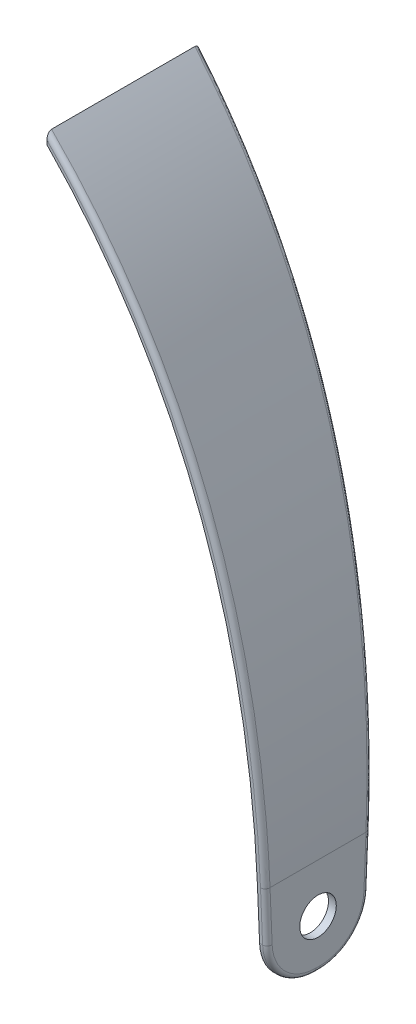
from build123d import *

# Parameters (mm, degrees)
BOSS_EXTRUDE1_DEPTH            = 22.225
CUT_EXTRUDE1_REACH             = 331.298
SKETCH2_R                      = 4.7625
CUT_EXTRUDE1_DIRECTION_2_REACH = 331.298
CUT_EXTRUDE2_DEPTH             = 254
FILLET1_R                      = 12.7
FILLET4_R                      = 1.2446
F_1_4_CLEARANCE_HOLE1_D        = 6.5278
F_1_4_CLEARANCE_HOLE1_DEPTH    = 6.35
F_1_4_CLEARANCE_HOLE1_TIP      = 1.961148974
SKETCH8_W                      = 63.920753762
SKETCH8_H                      = 259.326964074
CUT_EXTRUDE5_DEPTH             = 480.06
SKETCH9_R                      = 0.762
CUT_EXTRUDE6_DEPTH             = 0.508
SKETCH10_R                     = 0.762
BOSS_EXTRUDE2_DEPTH            = 0.508
SKETCH7_W                      = 53.894876093
SKETCH7_H                      = 277.088175353
CUT_EXTRUDE4_DEPTH             = 200.66


with BuildPart() as part:
    # Sketch1 → Boss-Extrude1 (new, symmetric)
    with BuildSketch(Plane.XY):
        with BuildLine():
            add(Edge.make_bspline(
                [(247.65, 12.7), (247.65, 151.138652105), (159.851901214, 215.9), (69.85, 215.9)],
                knots=[0, 0, 0, 0, 1, 1, 1, 1], degree=3))
            Line((69.85, 215.9), (-69.85, 215.9))
            add(Edge.make_bspline(
                [(-69.85, 215.9), (-159.851901214, 215.9), (-247.65, 151.138652105), (-247.65, 12.7)],
                knots=[0, 0, 0, 0, 1, 1, 1, 1], degree=3))
            Line((-247.65, 12.7), (-247.65, -12.7))
            Line((-247.65, -12.7), (-245.618, -12.7))
            Line((-245.618, -12.7), (-245.618, 12.7))
            add(Edge.make_bspline(
                [(-69.85, 213.868), (-75.40386678, 213.868), (-86.529134162, 213.367524052), (-108.503296863, 210.348405687), (-135.224023579, 202.760511588), (-165.078062417, 187.457160851), (-187.304904565, 169.454437631), (-203.008125467, 151.842675097), (-213.624406237, 137.012147223), (-222.956422719, 120.542434531), (-230.879834274, 102.41559311), (-237.26896978, 82.613605898), (-241.209008074, 64.702111997), (-243.466672055, 49.517673174), (-244.696729955, 37.702743517), (-245.322441099, 27.489835839), (-245.575395866, 19.120958406), (-245.618, 14.831688899), (-245.618, 12.7)],
                knots=[0, 0, 0, 0, 0.0625, 0.125, 0.25, 0.375, 0.5, 0.5625, 0.625, 0.6875, 0.75, 0.8125, 0.875, 0.90625, 0.9375, 0.96875, 0.984375, 1, 1, 1, 1], degree=3))
            Line((-69.85, 213.868), (69.85, 213.868))
            add(Edge.make_bspline(
                [(245.618, 12.7), (245.618, 14.831688899), (245.575395866, 19.120958406), (245.322441099, 27.489835839), (244.696729955, 37.702743517), (243.466672055, 49.517673174), (241.209008074, 64.702111997), (237.26896978, 82.613605898), (230.879834274, 102.41559311), (222.956422719, 120.542434531), (213.624406237, 137.012147223), (203.008125467, 151.842675097), (187.304904565, 169.454437631), (165.078062417, 187.457160851), (135.224023579, 202.760511588), (108.503296863, 210.348405687), (86.529134162, 213.367524052), (75.40386678, 213.868), (69.85, 213.868)],
                knots=[0, 0, 0, 0, 0.015625, 0.03125, 0.0625, 0.09375, 0.125, 0.1875, 0.25, 0.3125, 0.375, 0.4375, 0.5, 0.625, 0.75, 0.875, 0.9375, 1, 1, 1, 1], degree=3))
            Line((245.618, 12.7), (245.618, -12.7))
            Line((245.618, -12.7), (247.65, -12.7))
            Line((247.65, -12.7), (247.65, 12.7))
        make_face()
    extrude(amount=BOSS_EXTRUDE1_DEPTH, both=True)

    # Sketch2 → Cut-Extrude1 (cut, up to next)
    with BuildSketch(Plane(origin=(0, 0, 0), x_dir=(0, 0, -1), z_dir=(1, 0, 0)), mode=Mode.PRIVATE) as cut_extrude1_sk1:
        Circle(SKETCH2_R)
    cut_extrude1_tool1 = extrude(cut_extrude1_sk1.sketch, amount=-CUT_EXTRUDE1_REACH, mode=Mode.PRIVATE) & part.part
    add(cut_extrude1_tool1.solids().sort_by_distance((0, 0, 0))[0], mode=Mode.SUBTRACT)

    # Sketch2 → Cut-Extrude1 direction 2 (cut, up to next)
    with BuildSketch(Plane(origin=(0, 0, 0), x_dir=(0, 0, -1), z_dir=(1, 0, 0)), mode=Mode.PRIVATE) as cut_extrude1_direction_2_sk1:
        Circle(SKETCH2_R)
    cut_extrude1_direction_2_tool1 = extrude(cut_extrude1_direction_2_sk1.sketch, amount=CUT_EXTRUDE1_DIRECTION_2_REACH, mode=Mode.PRIVATE) & part.part
    add(cut_extrude1_direction_2_tool1.solids().sort_by_distance((0, 0, 0))[0], mode=Mode.SUBTRACT)

    # Sketch3 → Cut-Extrude2 (cut, symmetric)
    with BuildSketch(Plane(origin=(0, 0, 0), x_dir=(0, 0, -1), z_dir=(1, 0, 0))):
        Polygon((-22.225, 215.9), (-12.7, -12.7), (-47.625, -12.7), (-47.625, 215.9), align=None)
        Polygon((22.225, 215.9), (12.7, -12.7), (47.625, -12.7), (47.625, 215.9), align=None)
    extrude(amount=CUT_EXTRUDE2_DEPTH, both=True, mode=Mode.SUBTRACT)

    # Fillet1
    fillet1_edges = [part.edges().sort_by_distance(p)[0] for p in [
        (-246.634, -12.7, -12.7),
        (-246.634, -12.7, 12.7),
        (246.634, -12.7, -12.7),
        (246.634, -12.7, 12.7),
    ]]
    fillet(fillet1_edges, radius=FILLET1_R)

    # Fillet4
    fillet4_edges = [part.edges().sort_by_distance(p)[0] for p in [
        (247.65, -9.165276607, -9.309489742),
        (247.65, 6.085646041, -13.482735252),
        (-247.65, -9.165276607, -9.309489742),
        (-247.65, 6.085646041, -13.482735252),
        (247.65, -9.165276607, 9.309489742),
        (247.65, 6.085646041, 13.482735252),
        (-247.65, -9.165276607, 9.309489742),
        (-247.65, 6.085646041, 13.482735252),
        (0, 215.9, 22.225),
        (-203.084938623, 154.469294773, 19.665387282),
        (-247.65, -12.7, 0),
        (-203.084938623, 154.469294773, -19.665387282),
        (0, 215.9, -22.225),
        (203.084938625, 154.469294774, -19.665387282),
        (247.65, -12.7, 0),
        (203.084938625, 154.469294774, 19.665387282),
    ]]
    fillet(fillet4_edges, radius=FILLET4_R)

    # 1/4 Clearance Hole1
    with Locations(Plane(origin=(5.734151724, 215.9, -6.658847299), x_dir=(1, 0, 0), z_dir=(0, 1, 0))):
        with Locations((35.540848276, -16.183847299), (35.540848276, 2.866152701), (-47.009151724, -16.183847299), (-47.009151724, 2.866152701)):
            Hole(F_1_4_CLEARANCE_HOLE1_D / 2, depth=F_1_4_CLEARANCE_HOLE1_DEPTH)
            with Locations((0, 0, -(F_1_4_CLEARANCE_HOLE1_DEPTH + F_1_4_CLEARANCE_HOLE1_TIP / 2))):  # 118° drill point
                Cone(0, F_1_4_CLEARANCE_HOLE1_D / 2, F_1_4_CLEARANCE_HOLE1_TIP, mode=Mode.SUBTRACT)

    # Sketch8 → Cut-Extrude5 (cut)
    with BuildSketch(Plane.ZY.offset(-196.85)):
        with Locations((0.135769602, 94.203521296)):
            Rectangle(SKETCH8_W, SKETCH8_H)
    extrude(amount=CUT_EXTRUDE5_DEPTH, mode=Mode.SUBTRACT)

    # Sketch9 → Cut-Extrude6 (cut)
    with BuildSketch(Plane.ZY.offset(-196.85)):
        with Locations((-16.028769638, 160.132431528)):
            Circle(SKETCH9_R)
    extrude(amount=-CUT_EXTRUDE6_DEPTH, mode=Mode.SUBTRACT)

    # Sketch10 → Boss-Extrude2 (add)
    with BuildSketch(Plane.ZY.offset(-196.85)):
        with Locations((16.028769638, 160.132431528)):
            Circle(SKETCH10_R)
    extrude(amount=BOSS_EXTRUDE2_DEPTH)

    # Sketch7 → Cut-Extrude4 (cut)
    with BuildSketch(Plane.ZY.offset(69.85)):
        with Locations((-0.531372719, 92.342266691)):
            Rectangle(SKETCH7_W, SKETCH7_H)
    extrude(amount=CUT_EXTRUDE4_DEPTH, mode=Mode.SUBTRACT)


solid = part.part
